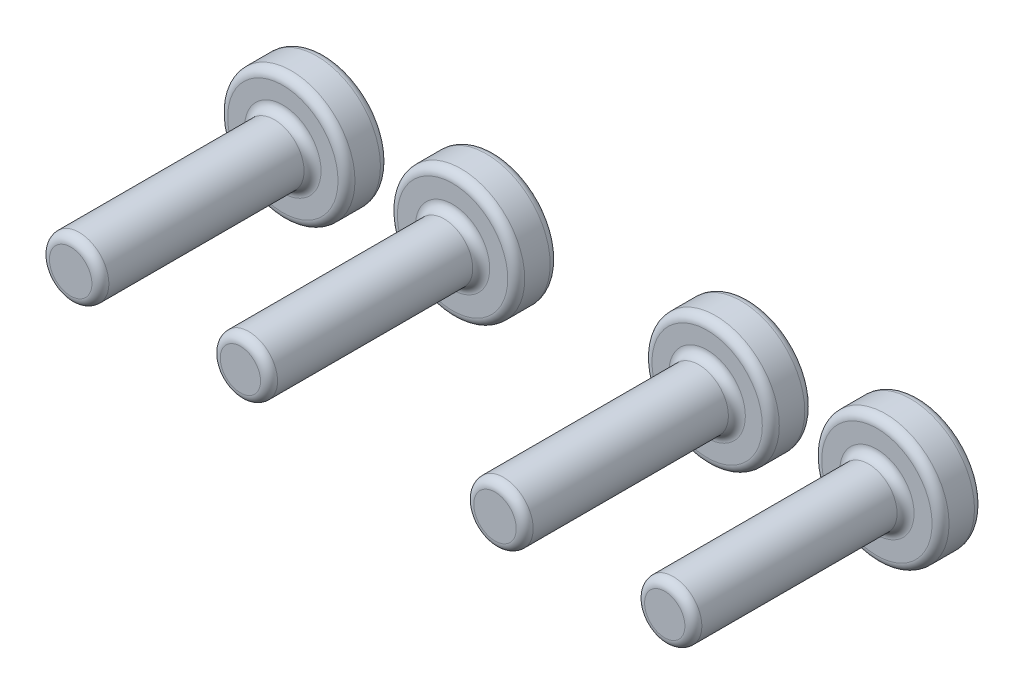
from build123d import *

# Parameters (mm, degrees)
SKETCH1_R             = 0.7
BOSS_EXTRUDE1_DEPTH   = 5
SKETCH1_R_2           = 0.675
BOSS_EXTRUDE1_2_DEPTH = 5
BOSS_EXTRUDE1_3_DEPTH = 5
BOSS_EXTRUDE1_4_DEPTH = 5
SKETCH2_R             = 1.5
BOSS_EXTRUDE2_DEPTH   = 1
FILLET1_R             = 0.2
FILLET2_R             = 0.2
FILLET3_R             = 0.2
FILLET4_R             = 0.2
CUT_EXTRUDE1_START    = -0.5
CUT_EXTRUDE1_DEPTH    = 1


with BuildPart() as part:
    # Sketch1 → Boss-Extrude1 (new body)
    with BuildSketch(Plane.XY):
        with Locations((-8.722955325, 2.915243555)):
            Circle(SKETCH1_R)
    extrude(amount=BOSS_EXTRUDE1_DEPTH)



with BuildPart() as body_2:
    # Sketch1 → Boss-Extrude1 2 (new body)
    with BuildSketch(Plane.XY):
        with Locations((-4.722955325, 2.915243555)):
            Circle(SKETCH1_R_2)
    extrude(amount=BOSS_EXTRUDE1_2_DEPTH)


with BuildPart() as body_3:
    # Sketch1 → Boss-Extrude1 3 (new body)
    with BuildSketch(Plane.XY):
        with Locations((5.277044675, 2.915243555)):
            Circle(SKETCH1_R_2)
    extrude(amount=BOSS_EXTRUDE1_3_DEPTH)


with BuildPart() as body_4:
    # Sketch1 → Boss-Extrude1 4 (new body)
    with BuildSketch(Plane.XY):
        with Locations((1.277044675, 2.915243555)):
            Circle(SKETCH1_R)
    extrude(amount=BOSS_EXTRUDE1_4_DEPTH)


with BuildPart() as part_1:
    add(part.part)

    add(body_2.part)  # Boss-Extrude2 merges body 2

    add(body_3.part)  # Boss-Extrude2 merges body 3

    add(body_4.part)  # Boss-Extrude2 merges body 4
    # Sketch2 → Boss-Extrude2 (add)
    with BuildSketch(Plane.XY):
        with Locations((-8.722955325, 2.915243555)):
            Circle(SKETCH2_R)
        with Locations((-4.722955325, 2.915243555)):
            Circle(SKETCH2_R)
        with Locations((5.277044675, 2.915243555)):
            Circle(SKETCH2_R)
        with Locations((1.277044675, 2.915243555)):
            Circle(SKETCH2_R)
    extrude(amount=-BOSS_EXTRUDE2_DEPTH)

    # Fillet1
    fillet1_edges = [part_1.edges().sort_by_distance(p)[0] for p in [
        (-10.222955325, 2.915243555, 0),
        (-10.222955325, 2.915243555, -1),
        (-9.422955325, 2.915243555, 0),
        (-9.422955325, 2.915243555, 5),
    ]]
    fillet(fillet1_edges, radius=FILLET1_R)

    # Fillet2
    fillet2_edges = [part_1.edges().sort_by_distance(p)[0] for p in [
        (-6.222955325, 2.915243555, -1),
        (-5.397955325, 2.915243555, 0),
        (-5.397955325, 2.915243555, 5),
        (-6.222955325, 2.915243555, 0),
    ]]
    fillet(fillet2_edges, radius=FILLET2_R)

    # Fillet3
    fillet3_edges = [part_1.edges().sort_by_distance(p)[0] for p in [
        (-0.222955325, 2.915243555, 0),
        (-0.222955325, 2.915243555, -1),
        (0.577044675, 2.915243555, 0),
        (0.577044675, 2.915243555, 5),
    ]]
    fillet(fillet3_edges, radius=FILLET3_R)

    # Fillet4
    fillet4_edges = [part_1.edges().sort_by_distance(p)[0] for p in [
        (4.602044675, 2.915243555, 0),
        (4.602044675, 2.915243555, 5),
        (3.777044675, 2.915243555, 0),
        (3.777044675, 2.915243555, -1),
    ]]
    fillet(fillet4_edges, radius=FILLET4_R)

    # Sketch3 → Cut-Extrude1 (cut)
    # profile 1 of 14: a face of its own
    with BuildSketch(Plane.XY.offset(CUT_EXTRUDE1_START)):
        Polygon((6.012403253, 3.225675252), (5.864486587, 3.225675252), (5.864486587, 2.425675252), (5.936281458, 2.425675252), (5.936281458, 3.14362397), (6.059358382, 3.14362397), align=None)
    # profile 2 of 14: a face of its own
    with BuildSketch(Plane.XY.offset(CUT_EXTRUDE1_START)):
        with BuildLine():
            add(Edge.make_bspline(
                [(5.438845561, 2.548752175), (5.434390655, 2.548487451), (5.425657334, 2.547968491), (5.413031247, 2.544408109), (5.401603896, 2.538086129), (5.391425098, 2.529660351), (5.383035046, 2.5194442), (5.376487765, 2.508107992), (5.372958397, 2.495376199), (5.372443217, 2.486592274), (5.372178894, 2.482085509)],
                knots=[0, 0, 0, 0, 1.020151414, 1.999887582, 2.974338812, 3.990962822, 5.007586832, 5.987933904, 6.967670073, 8, 8, 8, 8], degree=3))
            add(Edge.make_bspline(
                [(5.372178894, 2.482085509), (5.372452175, 2.477687033), (5.372991079, 2.469013304), (5.376479675, 2.456377541), (5.383084944, 2.445034249), (5.391367228, 2.434679475), (5.401606413, 2.426235847), (5.413058263, 2.419967654), (5.425627694, 2.416152344), (5.43438571, 2.415666333), (5.438845561, 2.415418842)],
                knots=[0, 0, 0, 0, 1.009421747, 1.99056486, 2.972319754, 3.999869655, 5.017953583, 5.993804169, 6.978383603, 8, 8, 8, 8], degree=3))
            add(Edge.make_bspline(
                [(5.438845561, 2.415418842), (5.443308625, 2.415657378), (5.452021695, 2.416123064), (5.464544208, 2.420045991), (5.476065801, 2.426177068), (5.486302993, 2.434695219), (5.494654643, 2.444980966), (5.500969016, 2.456455662), (5.50476105, 2.468977133), (5.505259764, 2.477679909), (5.505512228, 2.482085509)],
                knots=[0, 0, 0, 0, 1.022052826, 1.995314843, 2.982371812, 4.00089066, 5.028879526, 6.005146991, 6.990147033, 8, 8, 8, 8], degree=3))
            add(Edge.make_bspline(
                [(5.505512228, 2.482085509), (5.505269462, 2.486599652), (5.504795492, 2.495412964), (5.500961056, 2.508029903), (5.494703636, 2.519496975), (5.48624526, 2.529644765), (5.476068278, 2.53814472), (5.464572002, 2.544330958), (5.451991536, 2.547997338), (5.44330355, 2.548496199), (5.438845561, 2.548752175)],
                knots=[0, 0, 0, 0, 1.032775665, 2.016367738, 2.991239715, 4.008302682, 5.025365648, 6.011011707, 6.979408107, 8, 8, 8, 8], degree=3))
        make_face()
    # profile 3 of 14: a face of its own
    with BuildSketch(Plane.XY.offset(CUT_EXTRUDE1_START)):
        Polygon((4.832916074, 3.246188073), (4.81833274, 3.246188073), (4.81833274, 2.692341919), (4.726025048, 2.692341919), (4.726025048, 2.610290637), (4.81833274, 2.610290637), (4.81833274, 2.425675252), (4.890127612, 2.425675252), (4.890127612, 2.610290637), (5.269614792, 2.610290637), align=None)
        Polygon((4.890127612, 2.692341919), (4.890127612, 3.039777816), (5.128589151, 2.692341919), align=None, mode=Mode.SUBTRACT)
    # profile 4 of 14: a face of its own
    with BuildSketch(Plane.XY.offset(CUT_EXTRUDE1_START)):
        Polygon((2.330351971, 3.225675252), (2.182435305, 3.225675252), (2.182435305, 2.425675252), (2.254230176, 2.425675252), (2.254230176, 3.14362397), (2.377307099, 3.14362397), align=None)
    # profile 5 of 14: a face of its own
    with BuildSketch(Plane.XY.offset(CUT_EXTRUDE1_START)):
        with BuildLine():
            add(Edge.make_bspline(
                [(1.756794279, 2.548752175), (1.752339373, 2.548487451), (1.743606052, 2.547968491), (1.730979965, 2.544408109), (1.719552614, 2.538086129), (1.709373816, 2.529660351), (1.700983764, 2.5194442), (1.694436483, 2.508107992), (1.690907115, 2.495376199), (1.690391935, 2.486592274), (1.690127612, 2.482085509)],
                knots=[0, 0, 0, 0, 1.020151414, 1.999887582, 2.974338812, 3.990962822, 5.007586832, 5.987933904, 6.967670073, 8, 8, 8, 8], degree=3))
            add(Edge.make_bspline(
                [(1.690127612, 2.482085509), (1.690400892, 2.477687033), (1.690939797, 2.469013304), (1.694428393, 2.456377541), (1.701033662, 2.445034249), (1.709315946, 2.434679475), (1.719555131, 2.426235847), (1.731006981, 2.419967654), (1.743576412, 2.416152344), (1.752334428, 2.415666333), (1.756794279, 2.415418842)],
                knots=[0, 0, 0, 0, 1.009421747, 1.99056486, 2.972319754, 3.999869655, 5.017953583, 5.993804169, 6.978383603, 8, 8, 8, 8], degree=3))
            add(Edge.make_bspline(
                [(1.756794279, 2.415418842), (1.761257343, 2.415657378), (1.769970413, 2.416123064), (1.782492926, 2.420045991), (1.794014519, 2.426177068), (1.80425171, 2.434695219), (1.812603361, 2.444980966), (1.818917734, 2.456455662), (1.822709768, 2.468977133), (1.823208482, 2.477679909), (1.823460946, 2.482085509)],
                knots=[0, 0, 0, 0, 1.022052826, 1.995314843, 2.982371812, 4.00089066, 5.028879526, 6.005146991, 6.990147033, 8, 8, 8, 8], degree=3))
            add(Edge.make_bspline(
                [(1.823460946, 2.482085509), (1.82321818, 2.486599652), (1.82274421, 2.495412964), (1.818909774, 2.508029903), (1.812652354, 2.519496975), (1.804193978, 2.529644765), (1.794016996, 2.53814472), (1.78252072, 2.544330958), (1.769940254, 2.547997338), (1.761252268, 2.548496199), (1.756794279, 2.548752175)],
                knots=[0, 0, 0, 0, 1.032775665, 2.016367738, 2.991239715, 4.008302682, 5.025365648, 6.011011707, 6.979408107, 8, 8, 8, 8], degree=3))
        make_face()
    # profile 6 of 14: a face of its own
    with BuildSketch(Plane.XY.offset(CUT_EXTRUDE1_START)):
        with BuildLine():
            Line((1.484999407, 3.041059868), (1.556794279, 3.041059868))
            add(Edge.make_bspline(
                [(1.556794279, 3.041059868), (1.554849239, 3.049113007), (1.551046844, 3.064856235), (1.54311597, 3.087349323), (1.534476141, 3.1086347), (1.524101488, 3.128313802), (1.512785202, 3.146782123), (1.499820008, 3.16362078), (1.485804071, 3.179258029), (1.470301226, 3.193135341), (1.454043246, 3.205701679), (1.436801047, 3.216415977), (1.418921529, 3.225632927), (1.400280813, 3.233226123), (1.380823402, 3.238946242), (1.360725202, 3.243096369), (1.339933545, 3.245791481), (1.32581981, 3.246054513), (1.318653253, 3.246188073)],
                knots=[0, 0, 0, 0, 1.162005537, 2.271625781, 3.343758855, 4.383309926, 5.390229558, 6.379919256, 7.361854164, 8.333198761, 9.295911338, 10.242430842, 11.177959212, 12.116337295, 13.062827104, 14.020064771, 14.994644689, 16, 16, 16, 16], degree=3))
            add(Edge.make_bspline(
                [(1.318653253, 3.246188073), (1.308211484, 3.24587282), (1.28755571, 3.245249191), (1.25720987, 3.239554463), (1.227946598, 3.230543004), (1.200086198, 3.218091867), (1.174207699, 3.202734766), (1.151182285, 3.184457112), (1.131322054, 3.163611558), (1.114660482, 3.140586972), (1.101614768, 3.115979998), (1.091995025, 3.090654248), (1.086138641, 3.064669797), (1.085379657, 3.047125276), (1.084999407, 3.038335509)],
                knots=[0, 0, 0, 0, 1.083050992, 2.142477498, 3.193116406, 4.255571735, 5.30263384, 6.308962982, 7.297363603, 8.282367274, 9.249857812, 10.179914175, 11.08814088, 12, 12, 12, 12], degree=3))
            add(Edge.make_bspline(
                [(1.084999407, 3.038335509), (1.085265371, 3.029876813), (1.08578582, 3.013324457), (1.090204953, 2.989159544), (1.097641813, 2.966384321), (1.107943473, 2.944902912), (1.121278685, 2.92485152), (1.137432444, 2.906185031), (1.156518767, 2.888820652), (1.170982524, 2.878873344), (1.178428894, 2.873752175)],
                knots=[0, 0, 0, 0, 1.024540389, 2.004866551, 2.965041327, 3.920577974, 4.882998113, 5.874504559, 6.905732034, 8, 8, 8, 8], degree=3))
            add(Edge.make_bspline(
                [(1.178428894, 2.873752175), (1.169918779, 2.869642879), (1.153057779, 2.861501174), (1.130074801, 2.845534144), (1.109211287, 2.827098407), (1.097576151, 2.812711515), (1.091730176, 2.805482944)],
                knots=[0, 0, 0, 0, 1.015518401, 2.012035669, 3.001164323, 4, 4, 4, 4], degree=3))
            add(Edge.make_bspline(
                [(1.091730176, 2.805482944), (1.087880727, 2.800212601), (1.080244865, 2.78975822), (1.0708196, 2.772949894), (1.062268945, 2.755955268), (1.055606038, 2.738318833), (1.050446297, 2.720245001), (1.046758061, 2.701702739), (1.044466829, 2.682676905), (1.044138703, 2.669805481), (1.043973766, 2.663335509)],
                knots=[0, 0, 0, 0, 1.025084078, 2.033381695, 3.024893161, 4.013698104, 4.991890475, 5.976764909, 6.982997093, 8, 8, 8, 8], degree=3))
            add(Edge.make_bspline(
                [(1.043973766, 2.663335509), (1.044383941, 2.652133287), (1.045202359, 2.62978156), (1.052517576, 2.596758767), (1.063857746, 2.564478652), (1.079962188, 2.533604403), (1.099589047, 2.504717459), (1.122939293, 2.478871445), (1.149747615, 2.456654622), (1.179646049, 2.438092284), (1.212038535, 2.423253902), (1.246684385, 2.412955057), (1.283084397, 2.4062474), (1.308046065, 2.405528116), (1.320736587, 2.405162432)],
                knots=[0, 0, 0, 0, 0.955779014, 1.907060117, 2.875433937, 3.871313158, 4.872415639, 5.851225146, 6.836215519, 7.83643374, 8.849228613, 9.86973379, 10.916971861, 12, 12, 12, 12], degree=3))
            add(Edge.make_bspline(
                [(1.320736587, 2.405162432), (1.32928957, 2.40536088), (1.346118988, 2.405751361), (1.370860359, 2.408420756), (1.394476747, 2.413296186), (1.417000084, 2.419856941), (1.438450378, 2.428175054), (1.458762174, 2.438533613), (1.478060435, 2.450719099), (1.496163052, 2.464875348), (1.513067868, 2.480711083), (1.528325633, 2.498507428), (1.542190729, 2.517935406), (1.554291903, 2.539220676), (1.56518035, 2.562088163), (1.574135997, 2.586830677), (1.582018413, 2.613227025), (1.585683204, 2.631621937), (1.58756351, 2.641059868)],
                knots=[0, 0, 0, 0, 1.048658725, 2.063410685, 3.046034179, 4.001477787, 4.936774919, 5.862367409, 6.792675028, 7.730719943, 8.675894397, 9.627829632, 10.600096036, 11.597688215, 12.626045268, 13.701542398, 14.82072376, 16, 16, 16, 16], degree=3))
            Line((1.58756351, 2.641059868), (1.515768638, 2.641059868))
            add(Edge.make_bspline(
                [(1.515768638, 2.641059868), (1.513898171, 2.634900093), (1.510259951, 2.622918797), (1.504066969, 2.605675298), (1.497011364, 2.589867743), (1.489442322, 2.575380173), (1.481492963, 2.562069909), (1.472598123, 2.55028891), (1.463416604, 2.539519721), (1.456495609, 2.533452381), (1.453108382, 2.530482944)],
                knots=[0, 0, 0, 0, 1.198163088, 2.33053128, 3.407730985, 4.417276592, 5.372219308, 6.28897303, 7.162600585, 8, 8, 8, 8], degree=3))
            add(Edge.make_bspline(
                [(1.453108382, 2.530482944), (1.448629164, 2.527029611), (1.439684555, 2.520133604), (1.42510896, 2.511333231), (1.409779843, 2.503707854), (1.39336506, 2.49788301), (1.376218827, 2.492950973), (1.358064001, 2.489723426), (1.339060751, 2.487508986), (1.326085262, 2.487313573), (1.319454535, 2.487213714)],
                knots=[0, 0, 0, 0, 0.946170439, 1.889420265, 2.845303464, 3.807233317, 4.801018734, 5.828864929, 6.890507805, 8, 8, 8, 8], degree=3))
            add(Edge.make_bspline(
                [(1.319454535, 2.487213714), (1.31196802, 2.487354492), (1.297328787, 2.487629772), (1.275967676, 2.490161362), (1.255645974, 2.493848314), (1.236589305, 2.49954271), (1.218548046, 2.506578333), (1.201775098, 2.515412254), (1.186050274, 2.525776762), (1.171574981, 2.537557141), (1.158558865, 2.550453483), (1.147098405, 2.563942185), (1.137355625, 2.577966374), (1.129496521, 2.592603659), (1.123290681, 2.607793426), (1.11906595, 2.623578301), (1.116128461, 2.639829105), (1.115889235, 2.650875726), (1.115768638, 2.656444483)],
                knots=[0, 0, 0, 0, 1.217147791, 2.380027433, 3.494444702, 4.572153297, 5.609568379, 6.639424714, 7.649109417, 8.668170816, 9.669597737, 10.625200337, 11.543417969, 12.441394052, 13.322311151, 14.205496177, 15.095365482, 16, 16, 16, 16], degree=3))
            add(Edge.make_bspline(
                [(1.115768638, 2.656444483), (1.116118421, 2.663898503), (1.116816247, 2.678769454), (1.122143922, 2.700647756), (1.130907091, 2.721727394), (1.143175094, 2.741648717), (1.158108975, 2.76011178), (1.175563811, 2.776585262), (1.195684549, 2.790178426), (1.214203376, 2.799570118), (1.23060684, 2.805978593), (1.244644642, 2.810247156), (1.260360437, 2.813861706), (1.277564174, 2.817224511), (1.296385481, 2.820086533), (1.316803867, 2.822473234), (1.338823469, 2.824382958), (1.354067164, 2.825235779), (1.361922484, 2.825675252)],
                knots=[0, 0, 0, 0, 1.07054697, 2.135767047, 3.216561865, 4.33974944, 5.486079747, 6.621378074, 7.775625952, 8.963672916, 9.598146892, 10.304877434, 11.070270905, 11.915000392, 12.823868403, 13.805723172, 14.86925407, 16, 16, 16, 16], degree=3))
            Line((1.361922484, 2.825675252), (1.361922484, 2.907726534))
            add(Edge.make_bspline(
                [(1.361922484, 2.907726534), (1.352025075, 2.907894489), (1.332638481, 2.908223472), (1.304319783, 2.912202446), (1.277240169, 2.91770659), (1.251999771, 2.926137491), (1.22899435, 2.935929558), (1.209035584, 2.947324349), (1.192403093, 2.959990578), (1.179177706, 2.974123745), (1.169228168, 2.989281471), (1.161953471, 3.005079564), (1.157656254, 3.021656492), (1.157082616, 3.032969559), (1.156794279, 3.038656021)],
                knots=[0, 0, 0, 0, 1.321986639, 2.589447074, 3.816329219, 5.01088745, 6.139805852, 7.153945165, 8.075214402, 8.924034688, 9.728124013, 10.488707548, 11.240355623, 12, 12, 12, 12], degree=3))
            add(Edge.make_bspline(
                [(1.156794279, 3.038656021), (1.156889001, 3.042833792), (1.157077447, 3.051145268), (1.159453968, 3.06328814), (1.163025177, 3.075059785), (1.16793483, 3.086410142), (1.174506304, 3.09726049), (1.182370529, 3.107703336), (1.191734667, 3.117679057), (1.202465054, 3.126977415), (1.213987753, 3.135838955), (1.226616273, 3.143362072), (1.239969844, 3.149795229), (1.254063251, 3.155100258), (1.268942229, 3.159090953), (1.284536871, 3.161956288), (1.300876913, 3.163747752), (1.312024737, 3.164005676), (1.317691715, 3.164136791)],
                knots=[0, 0, 0, 0, 0.884392785, 1.759457502, 2.611959086, 3.489218968, 4.37281399, 5.2945488, 6.255912374, 7.266815255, 8.301784654, 9.332968512, 10.37626691, 11.440494194, 12.520033166, 13.637162961, 14.798855837, 16, 16, 16, 16], degree=3))
            add(Edge.make_bspline(
                [(1.317691715, 3.164136791), (1.326800668, 3.163818765), (1.344592571, 3.163197587), (1.370241695, 3.157756898), (1.394086114, 3.149076193), (1.412312095, 3.13871436), (1.425770969, 3.12848569), (1.435388555, 3.119552573), (1.444833243, 3.10962507), (1.453483683, 3.098091727), (1.462232021, 3.085733604), (1.470196492, 3.071922477), (1.47793585, 3.057018615), (1.48259929, 3.04648247), (1.484999407, 3.041059868)],
                knots=[0, 0, 0, 0, 1.472543308, 2.876219568, 4.221790263, 5.565193594, 6.249813518, 6.953379497, 7.687249741, 8.463570142, 9.283606569, 10.136032583, 11.040678096, 12, 12, 12, 12], degree=3))
        make_face()
    # profile 7 of 14: a face of its own
    with BuildSketch(Plane.XY.offset(CUT_EXTRUDE1_START)):
        with BuildLine():
            Line((0.469614792, 3.225675252), (0.469614792, 3.14362397))
            Line((0.469614792, 3.14362397), (0.741730176, 3.14362397))
            Line((0.741730176, 3.14362397), (0.784839151, 2.933207303))
            add(Edge.make_bspline(
                [(0.784839151, 2.933207303), (0.776369237, 2.935545651), (0.759960118, 2.94007583), (0.735740721, 2.945105721), (0.712748217, 2.948137822), (0.697828132, 2.948551836), (0.690608382, 2.948752175)],
                knots=[0, 0, 0, 0, 1.100273476, 2.13160584, 3.095893838, 4, 4, 4, 4], degree=3))
            add(Edge.make_bspline(
                [(0.690608382, 2.948752175), (0.681674955, 2.948558818), (0.664109607, 2.948178631), (0.638409277, 2.944527922), (0.613876044, 2.938781656), (0.590561216, 2.930754108), (0.568421662, 2.920489027), (0.547661076, 2.907666183), (0.527967839, 2.892687136), (0.509695246, 2.875465419), (0.493118262, 2.856511906), (0.478543178, 2.836132965), (0.466163158, 2.814526642), (0.456206414, 2.791486503), (0.448255709, 2.767267268), (0.442963824, 2.741614106), (0.439440005, 2.714768821), (0.439046317, 2.696413491), (0.438845561, 2.687053457)],
                knots=[0, 0, 0, 0, 1.052922333, 2.070308379, 3.05430497, 4.020497103, 4.973039431, 5.925935799, 6.892292201, 7.88610001, 8.88166317, 9.857072816, 10.836096531, 11.812156883, 12.81219415, 13.836441305, 14.89672472, 16, 16, 16, 16], degree=3))
            add(Edge.make_bspline(
                [(0.438845561, 2.687053457), (0.438997578, 2.680534093), (0.439299558, 2.667583467), (0.440835235, 2.648350507), (0.443791971, 2.629524716), (0.447761736, 2.611103598), (0.452914289, 2.593122027), (0.459151787, 2.575528535), (0.466785164, 2.558432625), (0.47515805, 2.541672535), (0.484585817, 2.525627162), (0.495049475, 2.510621679), (0.506104445, 2.496430986), (0.517999619, 2.483207276), (0.53084556, 2.471037443), (0.544486696, 2.459849265), (0.558814174, 2.449453532), (0.574049658, 2.44027223), (0.589853654, 2.431823554), (0.60645439, 2.42489246), (0.623473978, 2.418695768), (0.641157379, 2.413756448), (0.659464536, 2.409886149), (0.678425627, 2.407257441), (0.697941209, 2.405342826), (0.711169783, 2.405222973), (0.717851971, 2.405162432)],
                knots=[0, 0, 0, 0, 1.056347294, 2.098418968, 3.122841568, 4.141288669, 5.149314143, 6.15115421, 7.162517403, 8.180376062, 9.185164535, 10.17417709, 11.141909838, 12.097768115, 13.052685741, 14.0056014, 14.954263652, 15.917497458, 16.885230207, 17.854509472, 18.828990115, 19.81800267, 20.826176721, 21.857883937, 22.917946725, 24, 24, 24, 24], degree=3))
            add(Edge.make_bspline(
                [(0.717851971, 2.405162432), (0.725823213, 2.405320337), (0.741505688, 2.405630999), (0.764481818, 2.408880938), (0.786588013, 2.413535547), (0.807646322, 2.420538123), (0.827845468, 2.429312362), (0.846913518, 2.440401773), (0.865337695, 2.452968425), (0.882369018, 2.46779822), (0.89817613, 2.484007519), (0.912326189, 2.501597837), (0.924928149, 2.520278852), (0.935780206, 2.540141287), (0.945036896, 2.561132952), (0.952308894, 2.583332495), (0.958178232, 2.606623924), (0.960661299, 2.622659012), (0.961922484, 2.630803457)],
                knots=[0, 0, 0, 0, 1.0467383, 2.05933395, 3.04377827, 4.011590433, 4.970194871, 5.932262533, 6.905835911, 7.896367577, 8.894135286, 9.877477877, 10.858688626, 11.851381753, 12.8477658, 13.868841284, 14.917554742, 16, 16, 16, 16], degree=3))
            Line((0.961922484, 2.630803457), (0.890127612, 2.630803457))
            add(Edge.make_bspline(
                [(0.890127612, 2.630803457), (0.888361085, 2.623174554), (0.884965721, 2.608511378), (0.877512979, 2.587909928), (0.868400778, 2.569551249), (0.857565499, 2.553192487), (0.844639778, 2.538927573), (0.829890194, 2.526215102), (0.813353571, 2.514746501), (0.794977976, 2.505187011), (0.775592129, 2.497034153), (0.755302481, 2.491605194), (0.734661488, 2.487787848), (0.720700718, 2.487405731), (0.713685305, 2.487213714)],
                knots=[0, 0, 0, 0, 1.136247022, 2.183929868, 3.172523383, 4.106158343, 5.02341133, 5.958108904, 6.928429099, 7.938127109, 8.96079061, 9.975095812, 10.982467395, 12, 12, 12, 12], degree=3))
            add(Edge.make_bspline(
                [(0.713685305, 2.487213714), (0.70683766, 2.48740132), (0.693354592, 2.487770719), (0.67351199, 2.490613921), (0.654354761, 2.494992795), (0.636071937, 2.501545904), (0.618343585, 2.509510412), (0.601618152, 2.519731), (0.58541178, 2.53149329), (0.570228206, 2.544969091), (0.556322047, 2.559819307), (0.544034933, 2.575699854), (0.53380021, 2.592640848), (0.525175271, 2.610348997), (0.518625945, 2.629018382), (0.513953721, 2.648561507), (0.511210165, 2.669026646), (0.510832752, 2.682985345), (0.510640433, 2.690098329)],
                knots=[0, 0, 0, 0, 1.027316725, 2.022795036, 3.002884548, 3.971462791, 4.93288096, 5.914575861, 6.907176829, 7.935150275, 8.956128384, 9.956726525, 10.942570165, 11.921478529, 12.907843606, 13.90538589, 14.932640048, 16, 16, 16, 16], degree=3))
            add(Edge.make_bspline(
                [(0.510640433, 2.690098329), (0.510790942, 2.696515644), (0.511085544, 2.709076624), (0.513492531, 2.727453586), (0.517679268, 2.74484171), (0.52349044, 2.761324963), (0.530868613, 2.776918893), (0.539884913, 2.791639592), (0.550708547, 2.80529304), (0.563072407, 2.817885623), (0.576617102, 2.829507309), (0.591575672, 2.839414529), (0.607635084, 2.847749139), (0.62460185, 2.854941824), (0.642879541, 2.860107709), (0.662106199, 2.863986082), (0.682489447, 2.866229594), (0.696425604, 2.866540883), (0.703589151, 2.866700893)],
                knots=[0, 0, 0, 0, 1.045622112, 2.046656509, 3.013763289, 3.955457236, 4.890082067, 5.820317437, 6.762574623, 7.722996705, 8.69280354, 9.665887285, 10.63943826, 11.638615906, 12.663482002, 13.728887084, 14.832589034, 16, 16, 16, 16], degree=3))
            add(Edge.make_bspline(
                [(0.703589151, 2.866700893), (0.709790049, 2.866568187), (0.72259333, 2.866294181), (0.742232833, 2.864276696), (0.762870941, 2.861022), (0.78442854, 2.856545144), (0.806970371, 2.850686612), (0.830448862, 2.843666155), (0.85491338, 2.835272555), (0.871397432, 2.828933763), (0.879871202, 2.825675252)],
                knots=[0, 0, 0, 0, 0.817624296, 1.688186739, 2.600797293, 3.572016777, 4.590301741, 5.671205678, 6.80286297, 8, 8, 8, 8], degree=3))
            Line((0.879871202, 2.825675252), (0.79781992, 3.225675252))
            Line((0.79781992, 3.225675252), (0.469614792, 3.225675252))
        make_face()
    # profile 8 of 14: a face of its own
    with BuildSketch(Plane.XY.offset(CUT_EXTRUDE1_START)):
        Polygon((-3.813237772, 3.225675252), (-3.961154439, 3.225675252), (-3.961154439, 2.425675252), (-3.889359567, 2.425675252), (-3.889359567, 3.14362397), (-3.766282644, 3.14362397), align=None)
    # profile 9 of 14: a face of its own
    with BuildSketch(Plane.XY.offset(CUT_EXTRUDE1_START)):
        with BuildLine():
            add(Edge.make_bspline(
                [(-4.386795465, 2.548752175), (-4.39125037, 2.548487451), (-4.399983692, 2.547968491), (-4.412609778, 2.544408109), (-4.424037129, 2.538086129), (-4.434215928, 2.529660351), (-4.44260598, 2.5194442), (-4.44915326, 2.508107992), (-4.452682628, 2.495376199), (-4.453197808, 2.486592274), (-4.453462131, 2.482085509)],
                knots=[0, 0, 0, 0, 1.020151414, 1.999887582, 2.974338812, 3.990962822, 5.007586832, 5.987933904, 6.967670073, 8, 8, 8, 8], degree=3))
            add(Edge.make_bspline(
                [(-4.453462131, 2.482085509), (-4.453188851, 2.477687033), (-4.452649947, 2.469013304), (-4.44916135, 2.456377541), (-4.442556082, 2.445034249), (-4.434273798, 2.434679475), (-4.424034613, 2.426235847), (-4.412582762, 2.419967654), (-4.400013332, 2.416152344), (-4.391255315, 2.415666333), (-4.386795465, 2.415418842)],
                knots=[0, 0, 0, 0, 1.009421747, 1.99056486, 2.972319754, 3.999869655, 5.017953583, 5.993804169, 6.978383603, 8, 8, 8, 8], degree=3))
            add(Edge.make_bspline(
                [(-4.386795465, 2.415418842), (-4.3823324, 2.415657378), (-4.37361933, 2.416123064), (-4.361096817, 2.420045991), (-4.349575224, 2.426177068), (-4.339338033, 2.434695219), (-4.330986382, 2.444980966), (-4.324672009, 2.456455662), (-4.320879975, 2.468977133), (-4.320381261, 2.477679909), (-4.320128798, 2.482085509)],
                knots=[0, 0, 0, 0, 1.022052826, 1.995314843, 2.982371812, 4.00089066, 5.028879526, 6.005146991, 6.990147033, 8, 8, 8, 8], degree=3))
            add(Edge.make_bspline(
                [(-4.320128798, 2.482085509), (-4.320371564, 2.486599652), (-4.320845533, 2.495412964), (-4.32467997, 2.508029903), (-4.33093739, 2.519496975), (-4.339395766, 2.529644765), (-4.349572748, 2.53814472), (-4.361069023, 2.544330958), (-4.37364949, 2.547997338), (-4.382337476, 2.548496199), (-4.386795465, 2.548752175)],
                knots=[0, 0, 0, 0, 1.032775665, 2.016367738, 2.991239715, 4.008302682, 5.025365648, 6.011011707, 6.979408107, 8, 8, 8, 8], degree=3))
        make_face()
    # profile 10 of 14: a face of its own
    with BuildSketch(Plane.XY.offset(CUT_EXTRUDE1_START)):
        with BuildLine():
            Line((-4.658590336, 3.041059868), (-4.586795465, 3.041059868))
            add(Edge.make_bspline(
                [(-4.586795465, 3.041059868), (-4.588740505, 3.049113007), (-4.592542899, 3.064856235), (-4.600473773, 3.087349323), (-4.609113603, 3.1086347), (-4.619488255, 3.128313802), (-4.630804542, 3.146782123), (-4.643769736, 3.16362078), (-4.657785672, 3.179258029), (-4.673288518, 3.193135341), (-4.689546497, 3.205701679), (-4.706788696, 3.216415977), (-4.724668215, 3.225632927), (-4.743308931, 3.233226123), (-4.762766342, 3.238946242), (-4.782864541, 3.243096369), (-4.803656198, 3.245791481), (-4.817769933, 3.246054513), (-4.82493649, 3.246188073)],
                knots=[0, 0, 0, 0, 1.162005537, 2.271625781, 3.343758855, 4.383309926, 5.390229558, 6.379919256, 7.361854164, 8.333198761, 9.295911338, 10.242430842, 11.177959212, 12.116337295, 13.062827104, 14.020064771, 14.994644689, 16, 16, 16, 16], degree=3))
            add(Edge.make_bspline(
                [(-4.82493649, 3.246188073), (-4.83537826, 3.24587282), (-4.856034034, 3.245249191), (-4.886379873, 3.239554463), (-4.915643146, 3.230543004), (-4.943503546, 3.218091867), (-4.969382044, 3.202734766), (-4.992407459, 3.184457112), (-5.01226769, 3.163611558), (-5.028929262, 3.140586972), (-5.041974976, 3.115979998), (-5.051594718, 3.090654248), (-5.057451102, 3.064669797), (-5.058210087, 3.047125276), (-5.058590336, 3.038335509)],
                knots=[0, 0, 0, 0, 1.083050992, 2.142477498, 3.193116406, 4.255571735, 5.30263384, 6.308962982, 7.297363603, 8.282367274, 9.249857812, 10.179914175, 11.08814088, 12, 12, 12, 12], degree=3))
            add(Edge.make_bspline(
                [(-5.058590336, 3.038335509), (-5.058324373, 3.029876813), (-5.057803923, 3.013324457), (-5.05338479, 2.989159544), (-5.04594793, 2.966384321), (-5.03564627, 2.944902912), (-5.022311059, 2.92485152), (-5.0061573, 2.906185031), (-4.987070977, 2.888820652), (-4.97260722, 2.878873344), (-4.965160849, 2.873752175)],
                knots=[0, 0, 0, 0, 1.024540389, 2.004866551, 2.965041327, 3.920577974, 4.882998113, 5.874504559, 6.905732034, 8, 8, 8, 8], degree=3))
            add(Edge.make_bspline(
                [(-4.965160849, 2.873752175), (-4.973670965, 2.869642879), (-4.990531964, 2.861501174), (-5.013514943, 2.845534144), (-5.034378457, 2.827098407), (-5.046013593, 2.812711515), (-5.051859567, 2.805482944)],
                knots=[0, 0, 0, 0, 1.015518401, 2.012035669, 3.001164323, 4, 4, 4, 4], degree=3))
            add(Edge.make_bspline(
                [(-5.051859567, 2.805482944), (-5.055709017, 2.800212601), (-5.063344879, 2.78975822), (-5.072770144, 2.772949894), (-5.081320798, 2.755955268), (-5.087983706, 2.738318833), (-5.093143447, 2.720245001), (-5.096831683, 2.701702739), (-5.099122915, 2.682676905), (-5.099451041, 2.669805481), (-5.099615977, 2.663335509)],
                knots=[0, 0, 0, 0, 1.025084078, 2.033381695, 3.024893161, 4.013698104, 4.991890475, 5.976764909, 6.982997093, 8, 8, 8, 8], degree=3))
            add(Edge.make_bspline(
                [(-5.099615977, 2.663335509), (-5.099205803, 2.652133287), (-5.098387384, 2.62978156), (-5.091072167, 2.596758767), (-5.079731998, 2.564478652), (-5.063627555, 2.533604403), (-5.044000696, 2.504717459), (-5.020650451, 2.478871445), (-4.993842129, 2.456654622), (-4.963943695, 2.438092284), (-4.931551208, 2.423253902), (-4.896905359, 2.412955057), (-4.860505346, 2.4062474), (-4.835543678, 2.405528116), (-4.822853157, 2.405162432)],
                knots=[0, 0, 0, 0, 0.955779014, 1.907060117, 2.875433937, 3.871313158, 4.872415639, 5.851225146, 6.836215519, 7.83643374, 8.849228613, 9.86973379, 10.916971861, 12, 12, 12, 12], degree=3))
            add(Edge.make_bspline(
                [(-4.822853157, 2.405162432), (-4.814300174, 2.40536088), (-4.797470756, 2.405751361), (-4.772729385, 2.408420756), (-4.749112996, 2.413296186), (-4.72658966, 2.419856941), (-4.705139366, 2.428175054), (-4.68482757, 2.438533613), (-4.665529309, 2.450719099), (-4.647426691, 2.464875348), (-4.630521876, 2.480711083), (-4.61526411, 2.498507428), (-4.601399015, 2.517935406), (-4.58929784, 2.539220676), (-4.578409394, 2.562088163), (-4.569453747, 2.586830677), (-4.561571331, 2.613227025), (-4.557906539, 2.631621937), (-4.556026234, 2.641059868)],
                knots=[0, 0, 0, 0, 1.048658725, 2.063410685, 3.046034179, 4.001477787, 4.936774919, 5.862367409, 6.792675028, 7.730719943, 8.675894397, 9.627829632, 10.600096036, 11.597688215, 12.626045268, 13.701542398, 14.82072376, 16, 16, 16, 16], degree=3))
            Line((-4.556026234, 2.641059868), (-4.627821106, 2.641059868))
            add(Edge.make_bspline(
                [(-4.627821106, 2.641059868), (-4.629691572, 2.634900093), (-4.633329792, 2.622918797), (-4.639522775, 2.605675298), (-4.64657838, 2.589867743), (-4.654147422, 2.575380173), (-4.662096781, 2.562069909), (-4.670991621, 2.55028891), (-4.68017314, 2.539519721), (-4.687094135, 2.533452381), (-4.690481362, 2.530482944)],
                knots=[0, 0, 0, 0, 1.198163088, 2.33053128, 3.407730985, 4.417276592, 5.372219308, 6.28897303, 7.162600585, 8, 8, 8, 8], degree=3))
            add(Edge.make_bspline(
                [(-4.690481362, 2.530482944), (-4.69496058, 2.527029611), (-4.703905188, 2.520133604), (-4.718480784, 2.511333231), (-4.733809901, 2.503707854), (-4.750224683, 2.49788301), (-4.767370917, 2.492950973), (-4.785525743, 2.489723426), (-4.804528993, 2.487508986), (-4.817504481, 2.487313573), (-4.824135208, 2.487213714)],
                knots=[0, 0, 0, 0, 0.946170439, 1.889420265, 2.845303464, 3.807233317, 4.801018734, 5.828864929, 6.890507805, 8, 8, 8, 8], degree=3))
            add(Edge.make_bspline(
                [(-4.824135208, 2.487213714), (-4.831621723, 2.487354492), (-4.846260957, 2.487629772), (-4.867622067, 2.490161362), (-4.88794377, 2.493848314), (-4.907000438, 2.49954271), (-4.925041697, 2.506578333), (-4.941814646, 2.515412254), (-4.95753947, 2.525776762), (-4.972014763, 2.537557141), (-4.985030879, 2.550453483), (-4.996491339, 2.563942185), (-5.006234119, 2.577966374), (-5.014093222, 2.592603659), (-5.020299062, 2.607793426), (-5.024523794, 2.623578301), (-5.027461283, 2.639829105), (-5.027700509, 2.650875726), (-5.027821106, 2.656444483)],
                knots=[0, 0, 0, 0, 1.217147791, 2.380027433, 3.494444702, 4.572153297, 5.609568379, 6.639424714, 7.649109417, 8.668170816, 9.669597737, 10.625200337, 11.543417969, 12.441394052, 13.322311151, 14.205496177, 15.095365482, 16, 16, 16, 16], degree=3))
            add(Edge.make_bspline(
                [(-5.027821106, 2.656444483), (-5.027471322, 2.663898503), (-5.026773497, 2.678769454), (-5.021445821, 2.700647756), (-5.012682652, 2.721727394), (-5.00041465, 2.741648717), (-4.985480769, 2.76011178), (-4.968025933, 2.776585262), (-4.947905195, 2.790178426), (-4.929386368, 2.799570118), (-4.912982904, 2.805978593), (-4.898945101, 2.810247156), (-4.883229306, 2.813861706), (-4.866025569, 2.817224511), (-4.847204263, 2.820086533), (-4.826785877, 2.822473234), (-4.804766274, 2.824382958), (-4.789522579, 2.825235779), (-4.78166726, 2.825675252)],
                knots=[0, 0, 0, 0, 1.07054697, 2.135767047, 3.216561865, 4.33974944, 5.486079747, 6.621378074, 7.775625952, 8.963672916, 9.598146892, 10.304877434, 11.070270905, 11.915000392, 12.823868403, 13.805723172, 14.86925407, 16, 16, 16, 16], degree=3))
            Line((-4.78166726, 2.825675252), (-4.78166726, 2.907726534))
            add(Edge.make_bspline(
                [(-4.78166726, 2.907726534), (-4.791564669, 2.907894489), (-4.810951262, 2.908223472), (-4.839269961, 2.912202446), (-4.866349575, 2.91770659), (-4.891589973, 2.926137491), (-4.914595393, 2.935929558), (-4.934554159, 2.947324349), (-4.95118665, 2.959990578), (-4.964412038, 2.974123745), (-4.974361576, 2.989281471), (-4.981636272, 3.005079564), (-4.98593349, 3.021656492), (-4.986507128, 3.032969559), (-4.986795465, 3.038656021)],
                knots=[0, 0, 0, 0, 1.321986639, 2.589447074, 3.816329219, 5.01088745, 6.139805852, 7.153945165, 8.075214402, 8.924034688, 9.728124013, 10.488707548, 11.240355623, 12, 12, 12, 12], degree=3))
            add(Edge.make_bspline(
                [(-4.986795465, 3.038656021), (-4.986700742, 3.042833792), (-4.986512296, 3.051145268), (-4.984135776, 3.06328814), (-4.980564566, 3.075059785), (-4.975654914, 3.086410142), (-4.96908344, 3.09726049), (-4.961219214, 3.107703336), (-4.951855077, 3.117679057), (-4.941124689, 3.126977415), (-4.929601991, 3.135838955), (-4.916973471, 3.143362072), (-4.9036199, 3.149795229), (-4.889526493, 3.155100258), (-4.874647514, 3.159090953), (-4.859052873, 3.161956288), (-4.842712831, 3.163747752), (-4.831565006, 3.164005676), (-4.825898029, 3.164136791)],
                knots=[0, 0, 0, 0, 0.884392785, 1.759457502, 2.611959086, 3.489218968, 4.37281399, 5.2945488, 6.255912374, 7.266815255, 8.301784654, 9.332968512, 10.37626691, 11.440494194, 12.520033166, 13.637162961, 14.798855837, 16, 16, 16, 16], degree=3))
            add(Edge.make_bspline(
                [(-4.825898029, 3.164136791), (-4.816789076, 3.163818765), (-4.798997173, 3.163197587), (-4.773348049, 3.157756898), (-4.74950363, 3.149076193), (-4.731277649, 3.13871436), (-4.717818775, 3.12848569), (-4.708201189, 3.119552573), (-4.698756501, 3.10962507), (-4.69010606, 3.098091727), (-4.681357723, 3.085733604), (-4.673393252, 3.071922477), (-4.665653893, 3.057018615), (-4.660990454, 3.04648247), (-4.658590336, 3.041059868)],
                knots=[0, 0, 0, 0, 1.472543308, 2.876219568, 4.221790263, 5.565193594, 6.249813518, 6.953379497, 7.687249741, 8.463570142, 9.283606569, 10.136032583, 11.040678096, 12, 12, 12, 12], degree=3))
        make_face()
    # profile 11 of 14: a face of its own
    with BuildSketch(Plane.XY.offset(CUT_EXTRUDE1_START)):
        with BuildLine():
            Line((-5.673974952, 3.225675252), (-5.673974952, 3.14362397))
            Line((-5.673974952, 3.14362397), (-5.401859567, 3.14362397))
            Line((-5.401859567, 3.14362397), (-5.358750593, 2.933207303))
            add(Edge.make_bspline(
                [(-5.358750593, 2.933207303), (-5.367220507, 2.935545651), (-5.383629626, 2.94007583), (-5.407849023, 2.945105721), (-5.430841526, 2.948137822), (-5.445761611, 2.948551836), (-5.452981362, 2.948752175)],
                knots=[0, 0, 0, 0, 1.100273476, 2.13160584, 3.095893838, 4, 4, 4, 4], degree=3))
            add(Edge.make_bspline(
                [(-5.452981362, 2.948752175), (-5.461914788, 2.948558818), (-5.479480136, 2.948178631), (-5.505180467, 2.944527922), (-5.5297137, 2.938781656), (-5.553028527, 2.930754108), (-5.575168082, 2.920489027), (-5.595928667, 2.907666183), (-5.615621904, 2.892687136), (-5.633894497, 2.875465419), (-5.650471482, 2.856511906), (-5.665046565, 2.836132965), (-5.677426586, 2.814526642), (-5.68738333, 2.791486503), (-5.695334035, 2.767267268), (-5.700625919, 2.741614106), (-5.704149739, 2.714768821), (-5.704543427, 2.696413491), (-5.704744183, 2.687053457)],
                knots=[0, 0, 0, 0, 1.052922333, 2.070308379, 3.05430497, 4.020497103, 4.973039431, 5.925935799, 6.892292201, 7.88610001, 8.88166317, 9.857072816, 10.836096531, 11.812156883, 12.81219415, 13.836441305, 14.89672472, 16, 16, 16, 16], degree=3))
            add(Edge.make_bspline(
                [(-5.704744183, 2.687053457), (-5.704592165, 2.680534093), (-5.704290185, 2.667583467), (-5.702754508, 2.648350507), (-5.699797773, 2.629524716), (-5.695828008, 2.611103598), (-5.690675455, 2.593122027), (-5.684437957, 2.575528535), (-5.676804579, 2.558432625), (-5.668431693, 2.541672535), (-5.659003927, 2.525627162), (-5.648540268, 2.510621679), (-5.637485299, 2.496430986), (-5.625590125, 2.483207276), (-5.612744183, 2.471037443), (-5.599103048, 2.459849265), (-5.584775569, 2.449453532), (-5.569540085, 2.44027223), (-5.553736089, 2.431823554), (-5.537135354, 2.42489246), (-5.520115765, 2.418695768), (-5.502432365, 2.413756448), (-5.484125208, 2.409886149), (-5.465164116, 2.407257441), (-5.445648535, 2.405342826), (-5.43241996, 2.405222973), (-5.425737772, 2.405162432)],
                knots=[0, 0, 0, 0, 1.056347294, 2.098418968, 3.122841568, 4.141288669, 5.149314143, 6.15115421, 7.162517403, 8.180376062, 9.185164535, 10.17417709, 11.141909838, 12.097768115, 13.052685741, 14.0056014, 14.954263652, 15.917497458, 16.885230207, 17.854509472, 18.828990115, 19.81800267, 20.826176721, 21.857883937, 22.917946725, 24, 24, 24, 24], degree=3))
            add(Edge.make_bspline(
                [(-5.425737772, 2.405162432), (-5.417766531, 2.405320337), (-5.402084055, 2.405630999), (-5.379107926, 2.408880938), (-5.35700173, 2.413535547), (-5.335943421, 2.420538123), (-5.315744275, 2.429312362), (-5.296676226, 2.440401773), (-5.278252048, 2.452968425), (-5.261220726, 2.46779822), (-5.245413614, 2.484007519), (-5.231263555, 2.501597837), (-5.218661594, 2.520278852), (-5.207809538, 2.540141287), (-5.198552847, 2.561132952), (-5.19128085, 2.583332495), (-5.185411512, 2.606623924), (-5.182928444, 2.622659012), (-5.18166726, 2.630803457)],
                knots=[0, 0, 0, 0, 1.0467383, 2.05933395, 3.04377827, 4.011590433, 4.970194871, 5.932262533, 6.905835911, 7.896367577, 8.894135286, 9.877477877, 10.858688626, 11.851381753, 12.8477658, 13.868841284, 14.917554742, 16, 16, 16, 16], degree=3))
            Line((-5.18166726, 2.630803457), (-5.253462131, 2.630803457))
            add(Edge.make_bspline(
                [(-5.253462131, 2.630803457), (-5.255228659, 2.623174554), (-5.258624022, 2.608511378), (-5.266076765, 2.587909928), (-5.275188965, 2.569551249), (-5.286024245, 2.553192487), (-5.298949966, 2.538927573), (-5.31369955, 2.526215102), (-5.330236172, 2.514746501), (-5.348611768, 2.505187011), (-5.367997614, 2.497034153), (-5.388287262, 2.491605194), (-5.408928256, 2.487787848), (-5.422889026, 2.487405731), (-5.429904439, 2.487213714)],
                knots=[0, 0, 0, 0, 1.136247022, 2.183929868, 3.172523383, 4.106158343, 5.02341133, 5.958108904, 6.928429099, 7.938127109, 8.96079061, 9.975095812, 10.982467395, 12, 12, 12, 12], degree=3))
            add(Edge.make_bspline(
                [(-5.429904439, 2.487213714), (-5.436752083, 2.48740132), (-5.450235151, 2.487770719), (-5.470077754, 2.490613921), (-5.489234982, 2.494992795), (-5.507517807, 2.501545904), (-5.525246159, 2.509510412), (-5.541971592, 2.519731), (-5.558177964, 2.53149329), (-5.573361537, 2.544969091), (-5.587267697, 2.559819307), (-5.59955481, 2.575699854), (-5.609789534, 2.592640848), (-5.618414473, 2.610348997), (-5.624963798, 2.629018382), (-5.629636022, 2.648561507), (-5.632379579, 2.669026646), (-5.632756991, 2.682985345), (-5.632949311, 2.690098329)],
                knots=[0, 0, 0, 0, 1.027316725, 2.022795036, 3.002884548, 3.971462791, 4.93288096, 5.914575861, 6.907176829, 7.935150275, 8.956128384, 9.956726525, 10.942570165, 11.921478529, 12.907843606, 13.90538589, 14.932640048, 16, 16, 16, 16], degree=3))
            add(Edge.make_bspline(
                [(-5.632949311, 2.690098329), (-5.632798801, 2.696515644), (-5.6325042, 2.709076624), (-5.630097213, 2.727453586), (-5.625910476, 2.74484171), (-5.620099303, 2.761324963), (-5.61272113, 2.776918893), (-5.60370483, 2.791639592), (-5.592881197, 2.80529304), (-5.580517336, 2.817885623), (-5.566972641, 2.829507309), (-5.552014071, 2.839414529), (-5.53595466, 2.847749139), (-5.518987894, 2.854941824), (-5.500710203, 2.860107709), (-5.481483544, 2.863986082), (-5.461100297, 2.866229594), (-5.447164139, 2.866540883), (-5.440000593, 2.866700893)],
                knots=[0, 0, 0, 0, 1.045622112, 2.046656509, 3.013763289, 3.955457236, 4.890082067, 5.820317437, 6.762574623, 7.722996705, 8.69280354, 9.665887285, 10.63943826, 11.638615906, 12.663482002, 13.728887084, 14.832589034, 16, 16, 16, 16], degree=3))
            add(Edge.make_bspline(
                [(-5.440000593, 2.866700893), (-5.433799695, 2.866568187), (-5.420996414, 2.866294181), (-5.40135691, 2.864276696), (-5.380718802, 2.861022), (-5.359161203, 2.856545144), (-5.336619373, 2.850686612), (-5.313140881, 2.843666155), (-5.288676363, 2.835272555), (-5.272192312, 2.828933763), (-5.263718542, 2.825675252)],
                knots=[0, 0, 0, 0, 0.817624296, 1.688186739, 2.600797293, 3.572016777, 4.590301741, 5.671205678, 6.80286297, 8, 8, 8, 8], degree=3))
            Line((-5.263718542, 2.825675252), (-5.345769824, 3.225675252))
            Line((-5.345769824, 3.225675252), (-5.673974952, 3.225675252))
        make_face()
    # profile 12 of 14: a face of its own
    with BuildSketch(Plane.XY.offset(CUT_EXTRUDE1_START)):
        Polygon((-8.11067367, 3.225675252), (-8.258590336, 3.225675252), (-8.258590336, 2.425675252), (-8.186795465, 2.425675252), (-8.186795465, 3.14362397), (-8.063718542, 3.14362397), align=None)
    # profile 13 of 14: a face of its own
    with BuildSketch(Plane.XY.offset(CUT_EXTRUDE1_START)):
        with BuildLine():
            add(Edge.make_bspline(
                [(-8.684231362, 2.548752175), (-8.688686268, 2.548487451), (-8.697419589, 2.547968491), (-8.710045676, 2.544408109), (-8.721473027, 2.538086129), (-8.731651825, 2.529660351), (-8.740041877, 2.5194442), (-8.746589158, 2.508107992), (-8.750118526, 2.495376199), (-8.750633706, 2.486592274), (-8.750898029, 2.482085509)],
                knots=[0, 0, 0, 0, 1.020151414, 1.999887582, 2.974338812, 3.990962822, 5.007586832, 5.987933904, 6.967670073, 8, 8, 8, 8], degree=3))
            add(Edge.make_bspline(
                [(-8.750898029, 2.482085509), (-8.750624749, 2.477687033), (-8.750085844, 2.469013304), (-8.746597248, 2.456377541), (-8.739991979, 2.445034249), (-8.731709695, 2.434679475), (-8.72147051, 2.426235847), (-8.71001866, 2.419967654), (-8.697449229, 2.416152344), (-8.688691213, 2.415666333), (-8.684231362, 2.415418842)],
                knots=[0, 0, 0, 0, 1.009421747, 1.99056486, 2.972319754, 3.999869655, 5.017953583, 5.993804169, 6.978383603, 8, 8, 8, 8], degree=3))
            add(Edge.make_bspline(
                [(-8.684231362, 2.415418842), (-8.679768298, 2.415657378), (-8.671055228, 2.416123064), (-8.658532715, 2.420045991), (-8.647011122, 2.426177068), (-8.636773931, 2.434695219), (-8.62842228, 2.444980966), (-8.622107907, 2.456455662), (-8.618315873, 2.468977133), (-8.617817159, 2.477679909), (-8.617564695, 2.482085509)],
                knots=[0, 0, 0, 0, 1.022052826, 1.995314843, 2.982371812, 4.00089066, 5.028879526, 6.005146991, 6.990147033, 8, 8, 8, 8], degree=3))
            add(Edge.make_bspline(
                [(-8.617564695, 2.482085509), (-8.617807461, 2.486599652), (-8.618281431, 2.495412964), (-8.622115868, 2.508029903), (-8.628373287, 2.519496975), (-8.636831663, 2.529644765), (-8.647008645, 2.53814472), (-8.658504921, 2.544330958), (-8.671085387, 2.547997338), (-8.679773373, 2.548496199), (-8.684231362, 2.548752175)],
                knots=[0, 0, 0, 0, 1.032775665, 2.016367738, 2.991239715, 4.008302682, 5.025365648, 6.011011707, 6.979408107, 8, 8, 8, 8], degree=3))
        make_face()
    # profile 14 of 14: a face of its own
    with BuildSketch(Plane.XY.offset(CUT_EXTRUDE1_START)):
        Polygon((-9.290160849, 3.246188073), (-9.304744183, 3.246188073), (-9.304744183, 2.692341919), (-9.397051875, 2.692341919), (-9.397051875, 2.610290637), (-9.304744183, 2.610290637), (-9.304744183, 2.425675252), (-9.232949311, 2.425675252), (-9.232949311, 2.610290637), (-8.853462131, 2.610290637), align=None)
        Polygon((-9.232949311, 2.692341919), (-9.232949311, 3.039777816), (-8.994487772, 2.692341919), align=None, mode=Mode.SUBTRACT)
    extrude(amount=-CUT_EXTRUDE1_DEPTH, mode=Mode.SUBTRACT)


solid = part_1.part
